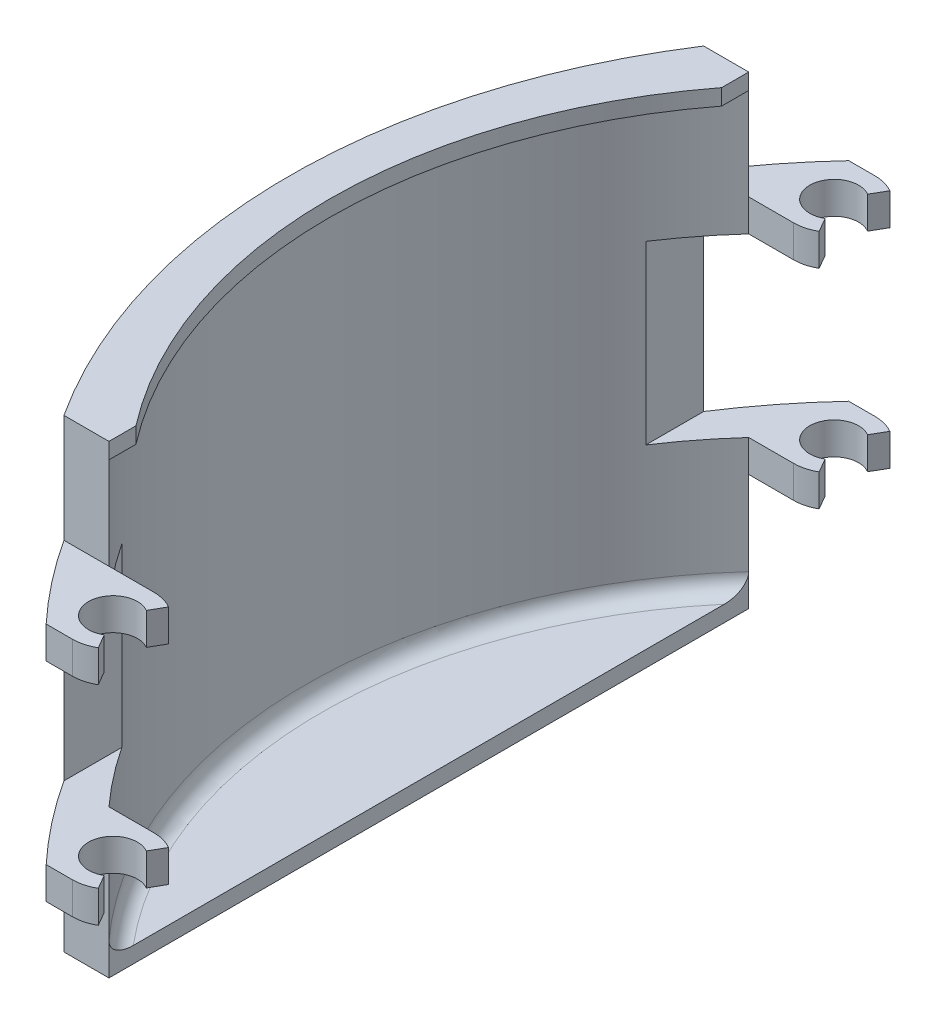
from build123d import *

# Parameters (mm, degrees)
SKETCH2_R               = 3.048
BOSS_EXTRUDE1_DEPTH     = 56
CUT_EXTRUDE2_DEPTH      = 118.2998702
CUT_EXTRUDE3_DEPTH      = 117.054836818
CUT_EXTRUDE3_DEPTH_BACK = 117.054836818
SKETCH12_W              = 5.816526385
SKETCH12_H              = 22
SKETCH12_H_2            = 11.5
SKETCH12_H_3            = 14.5
SKETCH13_W              = 10.16
SKETCH13_H              = 11.5
SKETCH13_H_2            = 14.5
CUT_EXTRUDE4_DEPTH      = 10
FILLET1_R               = 10
BOSS_EXTRUDE2_DEPTH     = 2
FILLET2_R               = 2
BOSS_EXTRUDE3_DEPTH     = 2
SKETCH18_W              = 2.878327065
SKETCH18_H              = 3.541775271
SKETCH18_W_2            = 3.166541323
SKETCH18_H_2            = 3.584686202
CUT_EXTRUDE5_DEPTH      = 2
CUT_EXTRUDE7_DEPTH      = 109.465199714
CUT_EXTRUDE7_DEPTH_BACK = 109.465199714
SKETCH19_W              = 7.941935835
SKETCH19_H              = 22


with BuildPart() as part:
    # Sketch2 → Boss-Extrude1 (new body)
    with BuildSketch(Plane(origin=(0, 0, 0), x_dir=(1, 0, 0), z_dir=(0, 1, 0))):
        with BuildLine():
            Line((0.095782763, 91.44), (5.683782763, 91.44))
            ThreePointArc((5.683782763, 91.44), (10.763782763, 96.52), (5.683782763, 101.6))
            Line((5.683782763, 101.6), (2.421245281, 101.6))
            ThreePointArc((2.421245281, 101.6), (-17.340690554, 51.52), (2.421245281, 1.44))
            Line((2.421245281, 1.44), (5.683782763, 1.44))
            ThreePointArc((5.683782763, 1.44), (10.763782763, 6.52), (5.683782763, 11.6))
            Line((5.683782763, 11.6), (0.095782763, 11.6))
            ThreePointArc((0.095782763, 11.6), (-15.340690554, 51.52), (0.095782763, 91.44))
        make_face()
        with Locations(Location((5.683782763, 96.52, 0), (0, 0, 270))):
            Circle(SKETCH2_R, mode=Mode.SUBTRACT)
        with Locations(Location((5.683782763, 6.52, 0), (0, 0, 90))):
            Circle(SKETCH2_R, mode=Mode.SUBTRACT)
    extrude(amount=BOSS_EXTRUDE1_DEPTH)

    # Sketch6 → Cut-Extrude2 (cut, symmetric)
    with BuildSketch(Plane(origin=(0, 56, 0), x_dir=(1, 0, 0), z_dir=(0, 1, 0))):
        Polygon((5.683782763, 6.52), (11.45705153, 16.593499718), (11.45705153, -3.406500282), align=None)
    cut_extrude2 = extrude(amount=CUT_EXTRUDE2_DEPTH, both=True, mode=Mode.SUBTRACT)

    # Mirror1: Cut-Extrude2 across plane
    add(cut_extrude2.mirror(Plane.XY.offset(-51.52)), mode=Mode.SUBTRACT)

    # Sketch12 → Cut-Extrude3 (cut, two sides: drawn at the far end of the back side and taken through both)
    with BuildSketch(Plane.XY.offset(-1.44).offset(-CUT_EXTRUDE3_DEPTH_BACK)):
        with Locations((5.329508474, 29.5)):
            Rectangle(SKETCH12_W, SKETCH12_H)
        with Locations((5.329508474, 50.25)):
            Rectangle(SKETCH12_W, SKETCH12_H_2)
        with Locations((5.329508474, 7.25)):
            Rectangle(SKETCH12_W, SKETCH12_H_3)
    extrude(amount=CUT_EXTRUDE3_DEPTH + CUT_EXTRUDE3_DEPTH_BACK, mode=Mode.SUBTRACT)

    # Sketch13 → Cut-Extrude4 (cut)
    with BuildSketch(Plane(origin=(2.421245281, 0, 0), x_dir=(0, 0, -1), z_dir=(1, 0, 0))):
        with Locations((6.52, 50.25)):
            Rectangle(SKETCH13_W, SKETCH13_H)
        with Locations((6.52, 7.25)):
            Rectangle(SKETCH13_W, SKETCH13_H_2)
        with Locations((96.52, 50.25)):
            Rectangle(SKETCH13_W, SKETCH13_H)
        with Locations((96.52, 7.25)):
            Rectangle(SKETCH13_W, SKETCH13_H_2)
    extrude(amount=-CUT_EXTRUDE4_DEPTH, mode=Mode.SUBTRACT)

    # Fillet1
    # the kernel refuses this fillet: 10 mm, written as the material it takes off along each edge
    with BuildSketch(Plane(origin=(2.421245281, 18.5, -91.44), x_dir=(0, 0, -1), z_dir=(0, 1, 0)), Plane(origin=(2.421245281, 40.5, -11.6), x_dir=(0, 0, 1), z_dir=(0, -1, 0))) as fillet1_piece_1:
        with BuildLine():
            CenterArc((6.411043164, 10), FILLET1_R, 230.125785038, 39.874214962)
            Line((0, 2.325462519), (0, 0))
            Line((0, 0), (6.411043164, 0))
        make_face()
    extrude(amount=22, mode=Mode.SUBTRACT)

    # Sketch15 → Boss-Extrude2 (add)
    with BuildSketch(Plane(origin=(0, 0, 0), x_dir=(-1, 0, 0), z_dir=(0, -1, 0))):
        with BuildLine():
            Line((-0.095782763, 11.6), (-0.095782763, 91.44))
            ThreePointArc((-0.095782763, 91.44), (15.340690554, 51.52), (-0.095782763, 11.6))
        make_face()
    extrude(amount=-BOSS_EXTRUDE2_DEPTH)

    # Fillet2
    fillet2_edges = [part.edges().sort_by_distance(p)[0] for p in [
        (-15.340690554, 2, -51.52),
    ]]
    fillet(fillet2_edges, radius=FILLET2_R)

    # Sketch17 → Boss-Extrude3 (add)
    with BuildSketch(Plane(origin=(0, 56, 0), x_dir=(1, 0, 0), z_dir=(0, 1, 0))):
        with BuildLine():
            Line((2.889782763, 91.44), (-5.523575239, 91.44))
            ThreePointArc((-5.523575239, 91.44), (-17.340690554, 51.52), (-5.523575239, 11.6))
            Line((-5.523575239, 11.6), (2.889782763, 11.6))
            ThreePointArc((2.889782763, 11.6), (-12.340690554, 51.52), (2.889782763, 91.44))
        make_face()
    extrude(amount=BOSS_EXTRUDE3_DEPTH)

    # Sketch18 → Cut-Extrude5 (cut)
    with BuildSketch(Plane(origin=(0, 58, 0), x_dir=(1, 0, 0), z_dir=(0, 1, 0))):
        with Locations((1.534946295, 13.370887636)):
            Rectangle(SKETCH18_W, SKETCH18_H)
        with Locations((1.679053424, 89.647656899)):
            Rectangle(SKETCH18_W_2, SKETCH18_H_2)
    extrude(amount=-CUT_EXTRUDE5_DEPTH, mode=Mode.SUBTRACT)

    # Sketch19 → Cut-Extrude7 (cut, two sides: drawn at the far end of the back side and taken through both)
    with BuildSketch(Plane.XY.offset(-11.6).offset(-CUT_EXTRUDE7_DEPTH_BACK)):
        with Locations((-1.549722637, 29.5)):
            Rectangle(SKETCH19_W, SKETCH19_H)
    extrude(amount=CUT_EXTRUDE7_DEPTH + CUT_EXTRUDE7_DEPTH_BACK, mode=Mode.SUBTRACT)


solid = part.part
